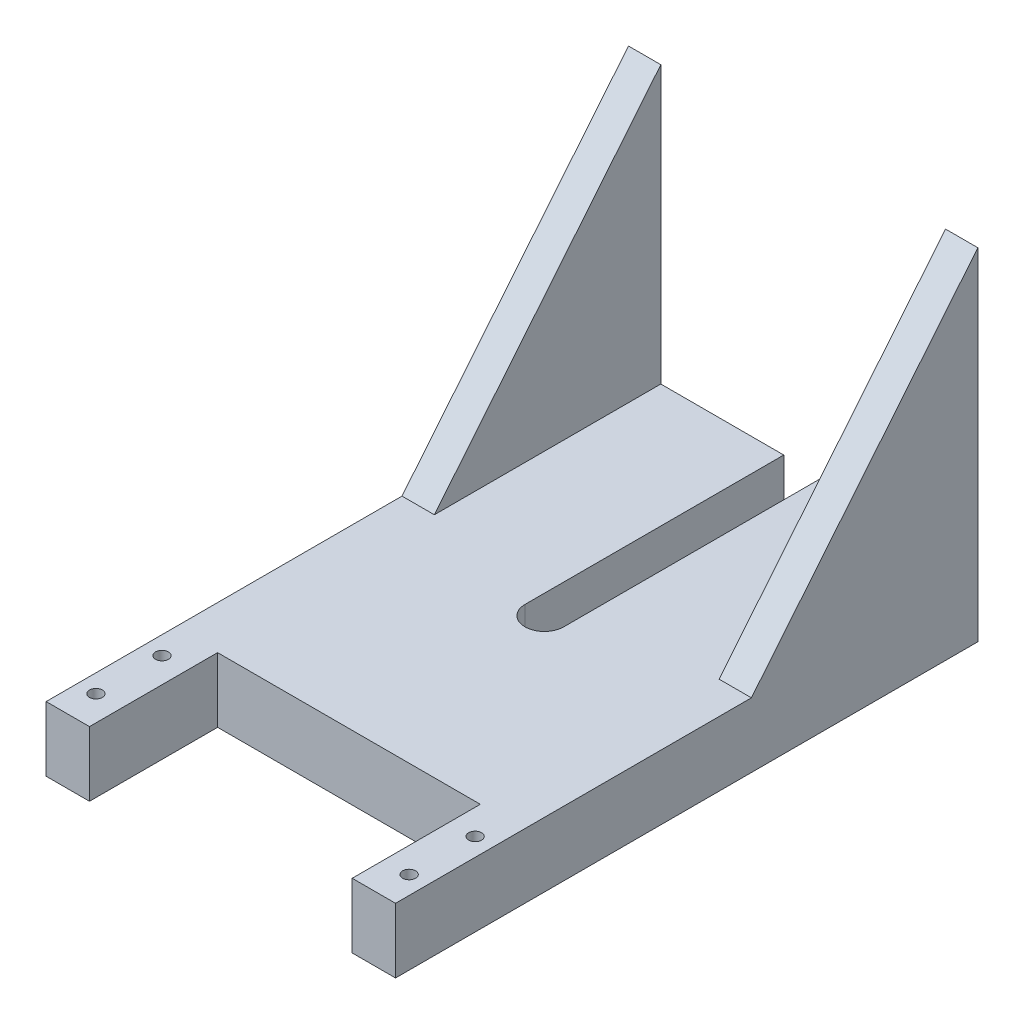
from build123d import *

# Parameters (mm, degrees)
SKETCH1_W           = 54
SKETCH1_H           = 10
BOSS_EXTRUDE1_DEPTH = 90
SKETCH2_W           = 40.6
SKETCH2_H           = 19.8
CUT_EXTRUDE1_DEPTH  = 99.192875432
CUT_EXTRUDE2_DEPTH  = 99.192875432
BOSS_EXTRUDE4_DEPTH = 5
BOSS_EXTRUDE5_DEPTH = 5
SKETCH9_R           = 1
CUT_EXTRUDE3_DEPTH  = 112.01184655


with BuildPart() as part:
    # Sketch1 → Boss-Extrude1 (new body)
    with BuildSketch(Plane.XY):
        with Locations((10.971578656, 527.175634265)):
            Rectangle(SKETCH1_W, SKETCH1_H)
    extrude(amount=BOSS_EXTRUDE1_DEPTH)

    # Sketch2 → Cut-Extrude1 (cut, through all)
    with BuildSketch(Plane.XZ.offset(-522.175634265)):
        with Locations((10.971578656, 80.1)):
            Rectangle(SKETCH2_W, SKETCH2_H)
    extrude(amount=-CUT_EXTRUDE1_DEPTH, mode=Mode.SUBTRACT)

    # Sketch4 → Cut-Extrude2 (cut, through all)
    with BuildSketch(Plane(origin=(0, 532.175634265, 0), x_dir=(1, 0, 0), z_dir=(0, 1, 0))):
        with BuildLine():
            Line((7.971578656, -40), (7.971578656, 0))
            ThreePointArc((7.971578656, 0), (10.971578656, 3), (13.971578656, 0))
            Line((13.971578656, 0), (13.971578656, -40))
            ThreePointArc((13.971578656, -40), (10.971578656, -43), (7.971578656, -40))
        make_face()
    extrude(amount=-CUT_EXTRUDE2_DEPTH, mode=Mode.SUBTRACT)

    # Sketch7 → Boss-Extrude4 (add)
    with BuildSketch(Plane.ZY.offset(16.028421344)):
        Polygon((35, 532.175634265), (0, 574.918304739), (0, 532.175634265), align=None)
    extrude(amount=-BOSS_EXTRUDE4_DEPTH)

    # Sketch8 → Boss-Extrude5 (add)
    with BuildSketch(Plane(origin=(37.971578656, 0, 0), x_dir=(0, 0, -1), z_dir=(1, 0, 0))):
        Polygon((-35, 532.175634265), (0, 574.918304739), (0, 532.175634265), align=None)
    extrude(amount=-BOSS_EXTRUDE5_DEPTH)

    # Sketch9 → Cut-Extrude3 (cut, through all)
    with BuildSketch(Plane.XZ.offset(-522.175634265)):
        with Locations((-13.228421344, 85.1)):
            Circle(SKETCH9_R)
        with Locations((-13.228421344, 74.9)):
            Circle(SKETCH9_R)
        with Locations((35.171578656, 74.9)):
            Circle(SKETCH9_R)
        with Locations((35.171578656, 85.1)):
            Circle(SKETCH9_R)
    extrude(amount=-CUT_EXTRUDE3_DEPTH, mode=Mode.SUBTRACT)


solid = part.part
